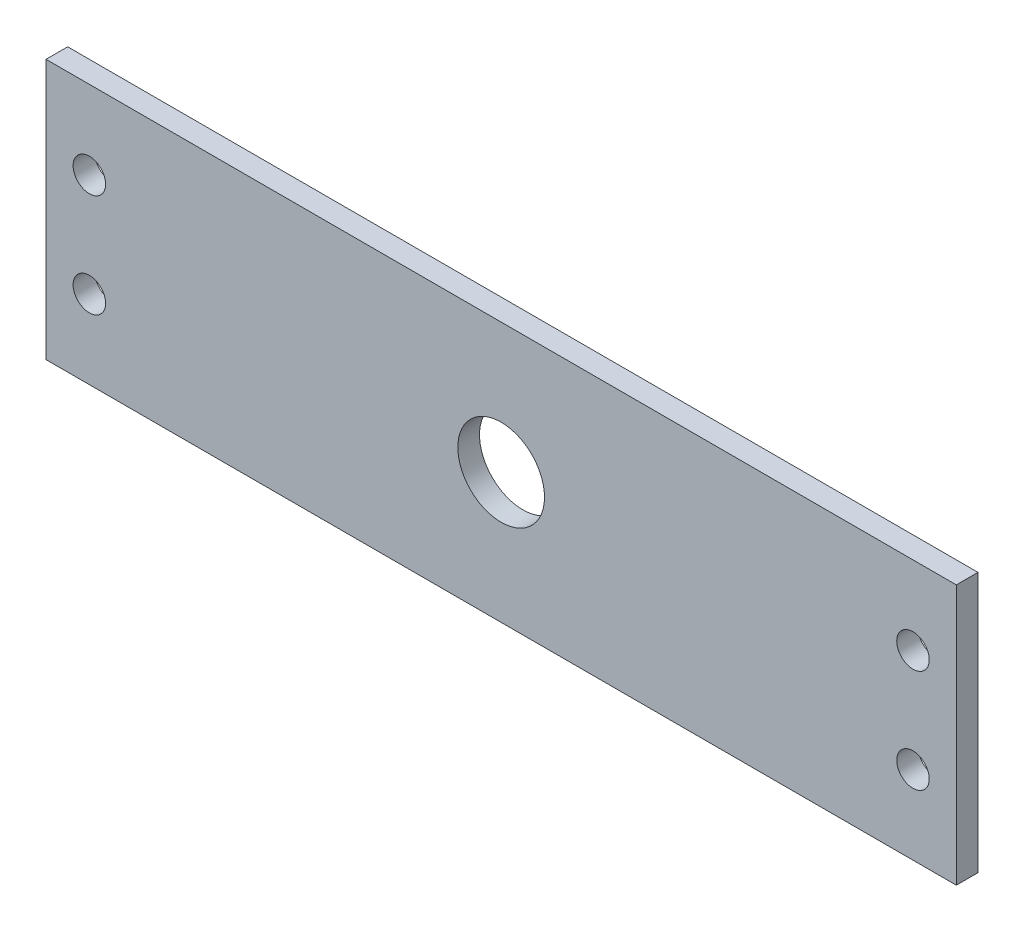
from build123d import *

# Parameters (mm, degrees)
SKETCH1_W           = 533.4
SKETCH1_H           = 152.4
BOSS_EXTRUDE1_DEPTH = 12.7
SKETCH2_R           = 9.525
SKETCH2_R_2         = 25.4
CUT_EXTRUDE1_DEPTH  = 555.889727784


with BuildPart() as part:
    # Sketch1 → Boss-Extrude1 (new body)
    with BuildSketch(Plane.XY):
        with Locations((266.7, 76.2)):
            Rectangle(SKETCH1_W, SKETCH1_H)
    extrude(amount=BOSS_EXTRUDE1_DEPTH)

    # Sketch2 → Cut-Extrude1 (cut, through all)
    with BuildSketch(Plane.XY.offset(12.7)):
        with Locations((508, 45.974)):
            Circle(SKETCH2_R)
        with Locations((508, 106.426)):
            Circle(SKETCH2_R)
        with Locations((25.4, 45.974)):
            Circle(SKETCH2_R)
        with Locations((25.4, 106.426)):
            Circle(SKETCH2_R)
        with Locations((266.7, 76.2)):
            Circle(SKETCH2_R_2)
    extrude(amount=-CUT_EXTRUDE1_DEPTH, mode=Mode.SUBTRACT)


solid = part.part
